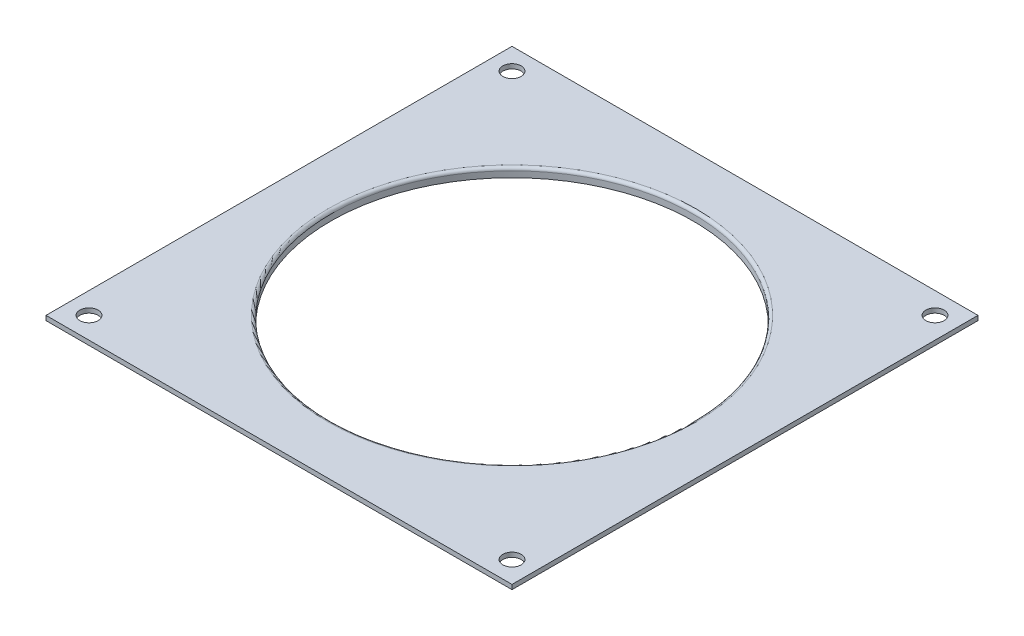
from build123d import *

# Parameters (mm, degrees)
CROQUIS1_W              = 155
CROQUIS1_H              = 155
CROQUIS1_R              = 60.3
SALIENTE_EXTRUIR1_DEPTH = 8
CORTAR_EXTRUIR4_REACH   = 111.893
CROQUIS3_R              = 3.04
REDONDEO1_R             = 1
CORTAR_EXTRUIR5_REACH   = 111.893
CROQUIS4_R              = 2.5
CROQUIS5_W              = 161.385983188
CROQUIS5_H              = 158.79059457
CORTAR_EXTRUIR6_DEPTH   = 30


with BuildPart() as part:
    # Croquis1 → Saliente-Extruir1 (new body)
    with BuildSketch(Plane(origin=(0, 0, 0), x_dir=(1, 0, 0), z_dir=(0, 1, 0))):
        Rectangle(CROQUIS1_W, CROQUIS1_H)
        Circle(CROQUIS1_R, mode=Mode.SUBTRACT)
    extrude(amount=SALIENTE_EXTRUIR1_DEPTH)

    # Croquis2 → Cortar-Revolución1 (revolve, cut)
    with BuildSketch(Plane.XY):
        with BuildLine():
            Line((63.057831326, 6.474140719), (73.221363367, 6.474140719))
            Line((73.221363367, 6.474140719), (118.605663226, 6.474140719))
            Line((118.605663226, 6.474140719), (118.605663226, 1.329441432))
            Line((118.605663226, 1.329441432), (77.5, 1.329441432))
            Line((77.5, 1.329441432), (62.888920691, 1.329441432))
            ThreePointArc((62.888920691, 1.329441432), (61.030350251, 3.965584448), (63.057831326, 6.474140719))
        make_face()
    revolve(axis=Axis((0, 0, 0), (0, 1, 0)), mode=Mode.SUBTRACT)

    # Croquis3 → Cortar-Extruir4 (cut, up to next)
    with BuildSketch(Plane(origin=(0, 8, 0), x_dir=(1, 0, 0), z_dir=(0, 1, 0)), mode=Mode.PRIVATE) as cortar_extruir4_sk1:
        with Locations((70.35005366, 70.35005366)):
            Circle(CROQUIS3_R)
    cortar_extruir4_tool1 = extrude(cortar_extruir4_sk1.sketch, amount=-CORTAR_EXTRUIR4_REACH, mode=Mode.PRIVATE) & part.part
    # Croquis3 → Cortar-Extruir4 (cut, up to next)
    with BuildSketch(Plane(origin=(0, 8, 0), x_dir=(1, 0, 0), z_dir=(0, 1, 0)), mode=Mode.PRIVATE) as cortar_extruir4_sk2:
        with Locations((-70.35005366, 70.35005366)):
            Circle(CROQUIS3_R)
    cortar_extruir4_tool2 = extrude(cortar_extruir4_sk2.sketch, amount=-CORTAR_EXTRUIR4_REACH, mode=Mode.PRIVATE) & part.part
    # Croquis3 → Cortar-Extruir4 (cut, up to next)
    with BuildSketch(Plane(origin=(0, 8, 0), x_dir=(1, 0, 0), z_dir=(0, 1, 0)), mode=Mode.PRIVATE) as cortar_extruir4_sk3:
        with Locations((-70.35005366, -70.35005366)):
            Circle(CROQUIS3_R)
    cortar_extruir4_tool3 = extrude(cortar_extruir4_sk3.sketch, amount=-CORTAR_EXTRUIR4_REACH, mode=Mode.PRIVATE) & part.part
    # Croquis3 → Cortar-Extruir4 (cut, up to next)
    with BuildSketch(Plane(origin=(0, 8, 0), x_dir=(1, 0, 0), z_dir=(0, 1, 0)), mode=Mode.PRIVATE) as cortar_extruir4_sk4:
        with Locations((70.35005366, -70.35005366)):
            Circle(CROQUIS3_R)
    cortar_extruir4_tool4 = extrude(cortar_extruir4_sk4.sketch, amount=-CORTAR_EXTRUIR4_REACH, mode=Mode.PRIVATE) & part.part
    add(cortar_extruir4_tool1.solids().sort_by_distance((70.350054, 8, -70.350054))[0], mode=Mode.SUBTRACT)
    add(cortar_extruir4_tool2.solids().sort_by_distance((-70.350054, 8, -70.350054))[0], mode=Mode.SUBTRACT)
    add(cortar_extruir4_tool3.solids().sort_by_distance((-70.350054, 8, 70.350054))[0], mode=Mode.SUBTRACT)
    add(cortar_extruir4_tool4.solids().sort_by_distance((70.350054, 8, 70.350054))[0], mode=Mode.SUBTRACT)

    # Redondeo1
    redondeo1_edges = [part.edges().sort_by_distance(p)[0] for p in [
        (-60.3, 0, 0),
        (-60.3, 8, 0),
    ]]
    fillet(redondeo1_edges, radius=REDONDEO1_R)

    # Croquis4 → Cortar-Extruir5 (cut, up to next)
    with BuildSketch(Plane.XZ, mode=Mode.PRIVATE) as cortar_extruir5_sk1:
        with Locations((-60, 60)):
            Circle(CROQUIS4_R)
    cortar_extruir5_tool1 = extrude(cortar_extruir5_sk1.sketch, amount=-CORTAR_EXTRUIR5_REACH, mode=Mode.PRIVATE) & part.part
    # Croquis4 → Cortar-Extruir5 (cut, up to next)
    with BuildSketch(Plane.XZ, mode=Mode.PRIVATE) as cortar_extruir5_sk2:
        with Locations((60, 60)):
            Circle(CROQUIS4_R)
    cortar_extruir5_tool2 = extrude(cortar_extruir5_sk2.sketch, amount=-CORTAR_EXTRUIR5_REACH, mode=Mode.PRIVATE) & part.part
    # Croquis4 → Cortar-Extruir5 (cut, up to next)
    with BuildSketch(Plane.XZ, mode=Mode.PRIVATE) as cortar_extruir5_sk3:
        with Locations((60, -60)):
            Circle(CROQUIS4_R)
    cortar_extruir5_tool3 = extrude(cortar_extruir5_sk3.sketch, amount=-CORTAR_EXTRUIR5_REACH, mode=Mode.PRIVATE) & part.part
    # Croquis4 → Cortar-Extruir5 (cut, up to next)
    with BuildSketch(Plane.XZ, mode=Mode.PRIVATE) as cortar_extruir5_sk4:
        with Locations((-60, -60)):
            Circle(CROQUIS4_R)
    cortar_extruir5_tool4 = extrude(cortar_extruir5_sk4.sketch, amount=-CORTAR_EXTRUIR5_REACH, mode=Mode.PRIVATE) & part.part
    add(cortar_extruir5_tool1.solids().sort_by_distance((-60, 0, 60))[0], mode=Mode.SUBTRACT)
    add(cortar_extruir5_tool2.solids().sort_by_distance((60, 0, 60))[0], mode=Mode.SUBTRACT)
    add(cortar_extruir5_tool3.solids().sort_by_distance((60, 0, -60))[0], mode=Mode.SUBTRACT)
    add(cortar_extruir5_tool4.solids().sort_by_distance((-60, 0, -60))[0], mode=Mode.SUBTRACT)

    # Croquis5 → Cortar-Extruir6 (cut)
    with BuildSketch(Plane(origin=(0, 5, 0), x_dir=(1, 0, 0), z_dir=(0, 1, 0))):
        Rectangle(CROQUIS5_W, CROQUIS5_H)
    extrude(amount=-CORTAR_EXTRUIR6_DEPTH, mode=Mode.SUBTRACT)


solid = part.part
